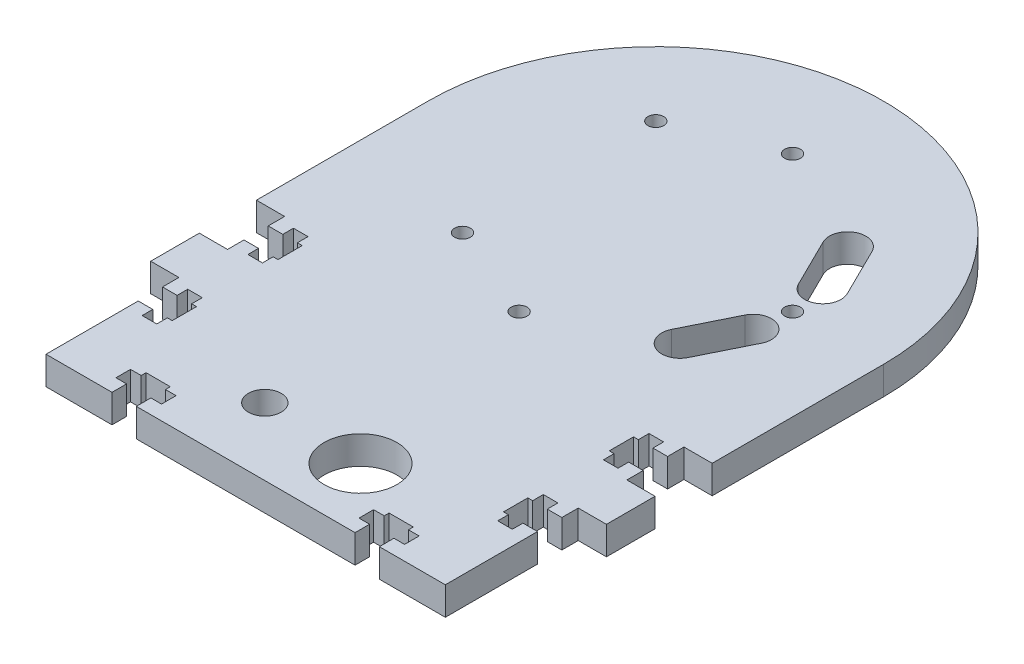
from build123d import *

# Parameters (mm, degrees)
SKETCH1_R           = 7.62
SKETCH1_R_2         = 1.651
SKETCH1_R_3         = 3.429
BOSS_EXTRUDE1_DEPTH = 5.8928


with BuildPart() as part:
    # Sketch1 → Boss-Extrude1 (new body)
    with BuildSketch(Plane(origin=(0, 0, 0), x_dir=(1, 0, 0), z_dir=(0, 1, 0))):
        with BuildLine():
            Line((47.625, -35.847515318), (47.625, 0))
            ThreePointArc((47.625, 0), (0, 47.625), (-47.625, 0))
            Line((-47.625, 0), (-47.625, -35.847515318))
            Line((-47.625, -35.847515318), (-41.7322, -35.847515318))
            Line((-41.7322, -35.847515318), (-41.7322, -39.276515318))
            Line((-41.7322, -39.276515318), (-38.6842, -39.276515318))
            Line((-38.6842, -39.276515318), (-38.6842, -37.054015318))
            Line((-38.6842, -37.054015318), (-35.6362, -37.054015318))
            Line((-35.6362, -37.054015318), (-35.6362, -39.276515318))
            Line((-35.6362, -39.276515318), (-34.6202, -39.276515318))
            Line((-34.6202, -39.276515318), (-34.6202, -44.356515318))
            Line((-34.6202, -44.356515318), (-35.6362, -44.356515318))
            Line((-35.6362, -44.356515318), (-35.6362, -46.579015318))
            Line((-35.6362, -46.579015318), (-38.6842, -46.579015318))
            Line((-38.6842, -46.579015318), (-38.6842, -44.356515318))
            Line((-38.6842, -44.356515318), (-41.7322, -44.356515318))
            Line((-41.7322, -44.356515318), (-41.7322, -47.785515318))
            Line((-41.7322, -47.785515318), (-47.625, -47.785515318))
            Line((-47.625, -47.785515318), (-47.625, -57.945515318))
            Line((-47.625, -57.945515318), (-41.7322, -57.945515318))
            Line((-41.7322, -57.945515318), (-41.7322, -61.374515318))
            Line((-41.7322, -61.374515318), (-38.6842, -61.374515318))
            Line((-38.6842, -61.374515318), (-38.6842, -59.152015318))
            Line((-38.6842, -59.152015318), (-35.6362, -59.152015318))
            Line((-35.6362, -59.152015318), (-35.6362, -61.374515318))
            Line((-35.6362, -61.374515318), (-34.6202, -61.374515318))
            Line((-34.6202, -61.374515318), (-34.6202, -66.454515318))
            Line((-34.6202, -66.454515318), (-35.6362, -66.454515318))
            Line((-35.6362, -66.454515318), (-35.6362, -68.677015318))
            Line((-35.6362, -68.677015318), (-38.6842, -68.677015318))
            Line((-38.6842, -68.677015318), (-38.6842, -66.454515318))
            Line((-38.6842, -66.454515318), (-41.7322, -66.454515318))
            Line((-41.7322, -66.454515318), (-41.7322, -85.725))
            Line((-41.7322, -85.725), (-27.94, -85.725))
            Line((-27.94, -85.725), (-27.94, -82.677))
            Line((-27.94, -82.677), (-30.1625, -82.677))
            Line((-30.1625, -82.677), (-30.1625, -79.629))
            Line((-30.1625, -79.629), (-27.94, -79.629))
            Line((-27.94, -79.629), (-27.94, -78.613))
            Line((-27.94, -78.613), (-22.86, -78.613))
            Line((-22.86, -78.613), (-22.86, -79.629))
            Line((-22.86, -79.629), (-20.6375, -79.629))
            Line((-20.6375, -79.629), (-20.6375, -82.677))
            Line((-20.6375, -82.677), (-22.86, -82.677))
            Line((-22.86, -82.677), (-22.86, -85.725))
            Line((-22.86, -85.725), (22.86, -85.725))
            Line((22.86, -85.725), (22.86, -82.677))
            Line((22.86, -82.677), (20.6375, -82.677))
            Line((20.6375, -82.677), (20.6375, -79.629))
            Line((20.6375, -79.629), (22.86, -79.629))
            Line((22.86, -79.629), (22.86, -78.613))
            Line((22.86, -78.613), (27.94, -78.613))
            Line((27.94, -78.613), (27.94, -79.629))
            Line((27.94, -79.629), (30.1625, -79.629))
            Line((30.1625, -79.629), (30.1625, -82.677))
            Line((30.1625, -82.677), (27.94, -82.677))
            Line((27.94, -82.677), (27.94, -85.725))
            Line((27.94, -85.725), (41.7322, -85.725))
            Line((41.7322, -85.725), (41.7322, -66.454515318))
            Line((41.7322, -66.454515318), (38.6842, -66.454515318))
            Line((38.6842, -66.454515318), (38.6842, -68.677015318))
            Line((38.6842, -68.677015318), (35.6362, -68.677015318))
            Line((35.6362, -68.677015318), (35.6362, -66.454515318))
            Line((35.6362, -66.454515318), (34.6202, -66.454515318))
            Line((34.6202, -66.454515318), (34.6202, -61.374515318))
            Line((34.6202, -61.374515318), (35.6362, -61.374515318))
            Line((35.6362, -61.374515318), (35.6362, -59.152015318))
            Line((35.6362, -59.152015318), (38.6842, -59.152015318))
            Line((38.6842, -59.152015318), (38.6842, -61.374515318))
            Line((38.6842, -61.374515318), (41.7322, -61.374515318))
            Line((41.7322, -61.374515318), (41.7322, -57.945515318))
            Line((41.7322, -57.945515318), (47.625, -57.945515318))
            Line((47.625, -57.945515318), (47.625, -47.785515318))
            Line((47.625, -47.785515318), (41.7322, -47.785515318))
            Line((41.7322, -47.785515318), (41.7322, -44.356515318))
            Line((41.7322, -44.356515318), (38.6842, -44.356515318))
            Line((38.6842, -44.356515318), (38.6842, -46.579015318))
            Line((38.6842, -46.579015318), (35.6362, -46.579015318))
            Line((35.6362, -46.579015318), (35.6362, -44.356515318))
            Line((35.6362, -44.356515318), (34.6202, -44.356515318))
            Line((34.6202, -44.356515318), (34.6202, -39.276515318))
            Line((34.6202, -39.276515318), (35.6362, -39.276515318))
            Line((35.6362, -39.276515318), (35.6362, -37.054015318))
            Line((35.6362, -37.054015318), (38.6842, -37.054015318))
            Line((38.6842, -37.054015318), (38.6842, -39.276515318))
            Line((38.6842, -39.276515318), (41.7322, -39.276515318))
            Line((41.7322, -39.276515318), (41.7322, -35.847515318))
            Line((41.7322, -35.847515318), (47.625, -35.847515318))
        make_face()
        with Locations((10.922, -72.644)):
            Circle(SKETCH1_R, mode=Mode.SUBTRACT)
        with Locations((0, 28.575)):
            Circle(SKETCH1_R_2, mode=Mode.SUBTRACT)
        with Locations((-20.205576272, -20.205576272)):
            Circle(SKETCH1_R_2, mode=Mode.SUBTRACT)
        with Locations((0, -28.575)):
            Circle(SKETCH1_R_2, mode=Mode.SUBTRACT)
        with Locations((-20.205576272, 20.205576272)):
            Circle(SKETCH1_R_2, mode=Mode.SUBTRACT)
        with BuildLine():
            Line((19.153758423, -15.837867121), (24.216771881, -5.59038964))
            ThreePointArc((24.216771881, -5.59038964), (29.320268861, -3.862234966), (31.048423535, -8.965731946))
            Line((31.048423535, -8.965731946), (25.985410077, -19.213209427))
            ThreePointArc((25.985410077, -19.213209427), (20.881913097, -20.941364101), (19.153758423, -15.837867121))
        make_face(mode=Mode.SUBTRACT)
        with Locations((28.575, 0)):
            Circle(SKETCH1_R_2, mode=Mode.SUBTRACT)
        with BuildLine():
            ThreePointArc((31.048423535, 8.965731946), (29.320268861, 3.862234966), (24.216771881, 5.59038964))
            Line((24.216771881, 5.59038964), (19.153758423, 15.837867121))
            ThreePointArc((19.153758423, 15.837867121), (20.881913097, 20.941364101), (25.985410077, 19.213209427))
            Line((25.985410077, 19.213209427), (31.048423535, 8.965731946))
        make_face(mode=Mode.SUBTRACT)
        with Locations((-10.074802893, -71.647533668)):
            Circle(SKETCH1_R_3, mode=Mode.SUBTRACT)
    extrude(amount=BOSS_EXTRUDE1_DEPTH)


solid = part.part
